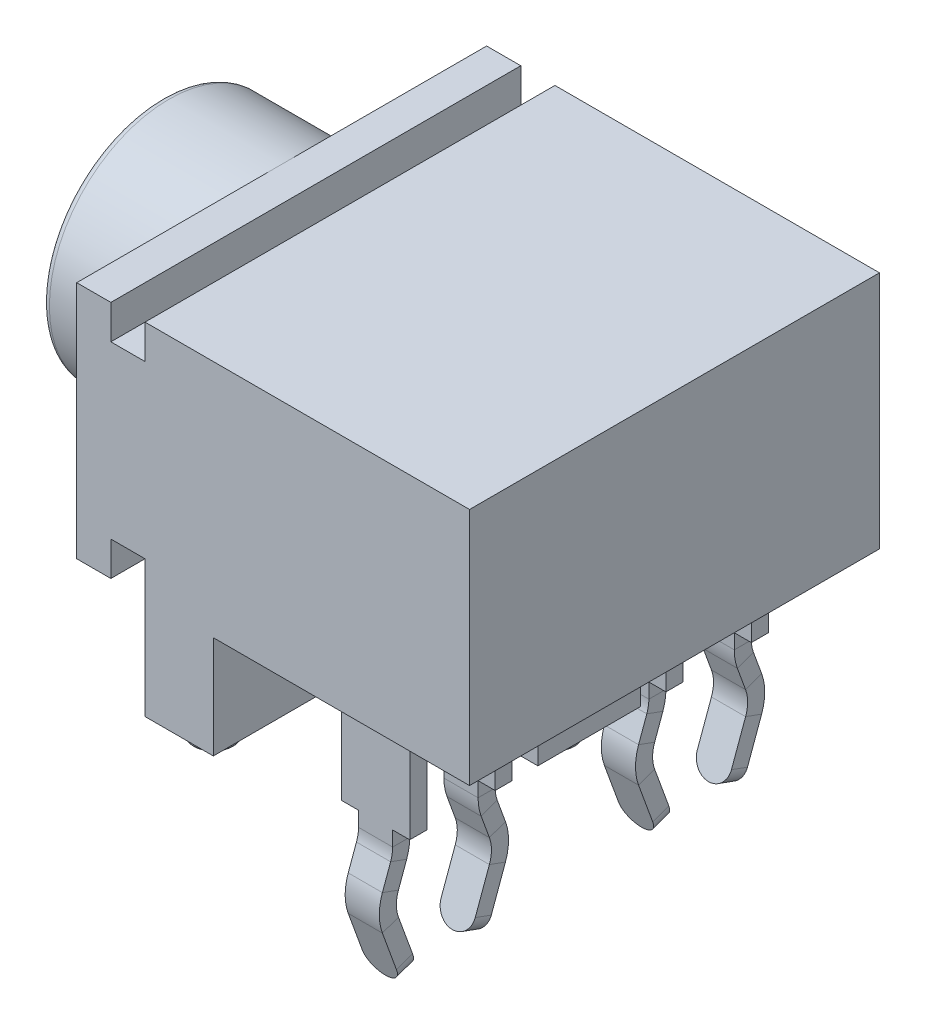
from build123d import *

# Parameters (mm, degrees)
SKETCH1_W              = 11.5
SKETCH1_H              = 12
EXTRUDE_1204_DEPTH     = 10
SKETCH4_R              = 3.5
SKETCH4_R_2            = 1.8
EXTRUDE_1491_DEPTH     = 3.5
FILLET_2_R             = 0.2
SKETCH_4_W             = 1
SKETCH_4_H             = 12
CUT_EXTRUDE_1957_DEPTH = 1
SKETCH_12_W            = 2
SKETCH_12_H            = 12
CUT_EXTRUDE_2288_DEPTH = 3
CUT_EXTRUDE_2733_DEPTH = 3
SKETCH_20_W            = 1
SKETCH_20_H            = 12
CUT_EXTRUDE_2_DEPTH    = 1
SKETCH3_R              = 0.6
EXTRUDE_3529_DEPTH     = 0.5
FILLET_4_R             = 0.1
SM_BASE_FLANGE_1_DEPTH = 0.5
OTHER_START            = 4.5
OTHER_8_DEPTH          = 1
OTHER_8_2_DEPTH        = 1
OTHER_9_DEPTH          = 1
OTHER_9_2_DEPTH        = 1
FILLET_5_R             = 0.499
SKETCH_42_W            = 0.5
SKETCH_42_H            = 4
SM_BASE_FLANGE_3_DEPTH = 1
OTHER_START_2          = -0.25
OTHER_19_DEPTH         = 0.5
OTHER_19_2_DEPTH       = 0.5
OTHER_20_DEPTH         = 0.5
OTHER_20_2_DEPTH       = 0.5
FILLET_6_R             = 0.499


# Read off the part's stored shape, not the designer's step: Нарисованный сгиб8, Нарисованный сгиб9, Нарисованный сгиб19, Нарисованный сгиб20
# Sheet-metal steps are written as plain solids
with BuildPart() as part:
    # Sketch1 → Extrude 1204 (new body)
    with BuildSketch(Plane(origin=(0, 0, 0), x_dir=(1, 0, 0), z_dir=(0, 1, 0))):
        with Locations((2.75, 0)):
            Rectangle(SKETCH1_W, SKETCH1_H)
    extrude(amount=EXTRUDE_1204_DEPTH)

    # Sketch4 → Extrude 1491 (add)
    with BuildSketch(Plane(origin=(-3, 0, 0), x_dir=(0, 0, -1), z_dir=(1, 0, 0))):
        with Locations((0, 6.5)):
            Circle(SKETCH4_R)
        with Locations((0, 6.5)):
            Circle(SKETCH4_R_2, mode=Mode.SUBTRACT)
    extrude(amount=-EXTRUDE_1491_DEPTH)

    # Скругление2
    fillet_2_edges = [part.edges().sort_by_distance(p)[0] for p in [
        (-6.5, 6.5, 3.5),
        (-6.5, 6.5, 1.8),
    ]]
    fillet(fillet_2_edges, radius=FILLET_2_R)

    # Эскиз4 → Cut-Extrude 1957 (cut)
    with BuildSketch(Plane(origin=(0, 10, 0), x_dir=(1, 0, 0), z_dir=(0, 1, 0))):
        with Locations((-1.5, 0)):
            Rectangle(SKETCH_4_W, SKETCH_4_H)
    extrude(amount=-CUT_EXTRUDE_1957_DEPTH, mode=Mode.SUBTRACT)

    # Эскиз12 → Cut-Extrude 2288 (cut)
    with BuildSketch(Plane.XZ):
        with Locations((-2, 0)):
            Rectangle(SKETCH_12_W, SKETCH_12_H)
    extrude(amount=-CUT_EXTRUDE_2288_DEPTH, mode=Mode.SUBTRACT)

    # Эскиз13 → Cut-Extrude 2733 (cut)
    with BuildSketch(Plane.XZ):
        Polygon((1, -6), (8.5, -6), (8.5, 6), (1, 6), (1, 1.5), (6, 1.5), (6, -1.5), (1, -1.5), align=None)
    extrude(amount=-CUT_EXTRUDE_2733_DEPTH, mode=Mode.SUBTRACT)

    # Эскиз20 → Нижний паз 2 (cut)
    with BuildSketch(Plane.XZ.offset(-3)):
        with Locations((-1.5, 0)):
            Rectangle(SKETCH_20_W, SKETCH_20_H)
    extrude(amount=-CUT_EXTRUDE_2_DEPTH, mode=Mode.SUBTRACT)

    # Sketch3 → Extrude 3529 (add)
    with BuildSketch(Plane.XZ):
        with Locations(Location((0, 5, 0), (0, 0, 90))):
            Circle(SKETCH3_R)
        with Locations(Location((5, 0, 0), (0, 0, 90))):
            Circle(SKETCH3_R)
        with Locations(Location((0, -5, 0), (0, 0, 90))):
            Circle(SKETCH3_R)
    extrude(amount=EXTRUDE_3529_DEPTH)

    # Скругление4
    fillet_4_edges = [part.edges().sort_by_distance(p)[0] for p in [
        (0, -0.5, 4.4),
        (5, -0.5, -0.6),
        (0, -0.5, -5.6),
    ]]
    fillet(fillet_4_edges, radius=FILLET_4_R)


with BuildPart() as body_2:
    # Эскиз23 → Базовая кромка1 (new body)
    with BuildSketch(Plane.XY.offset(4.75)):
        Polygon((4, 3), (4, 0), (4.5, 0), (4.5, -4), (5.5, -4), (5.5, 0), (6, 0), (6, 3), align=None)
    extrude(amount=SM_BASE_FLANGE_1_DEPTH)

    # Other 8 outline → Other 8 (cut)
    with BuildSketch(Plane.YZ.offset(OTHER_START)):
        with BuildLine():
            ThreePointArc((-0.434210549, 4.75), (-0.694682816, 4.77278837), (-0.947240764, 4.840461069))
            Line((-0.947240764, 4.840461069), (-2.07243973, 5.25))
            Line((-2.07243973, 5.25), (-4, 5.25))
            Line((-4, 5.25), (-4, 4.75))
            Line((-4, 4.75), (-0.434210549, 4.75))
        make_face()
    extrude(amount=OTHER_8_DEPTH, mode=Mode.SUBTRACT)

    # Other 8 2 outline → Other 8 2 (add)
    with BuildSketch(Plane.YZ.offset(OTHER_START)):
        with BuildLine():
            Line((-3.937170734, 5.92870658), (-2.07243973, 5.25))
            Line((-2.07243973, 5.25), (-0.434210549, 5.25))
            ThreePointArc((-0.434210549, 5.25), (-0.607858727, 5.265192247), (-0.776230693, 5.310307379))
            Line((-0.776230693, 5.310307379), (-3.766160663, 6.398552891))
            Line((-3.766160663, 6.398552891), (-3.937170734, 5.92870658))
        make_face()
    extrude(amount=OTHER_8_2_DEPTH)

    # Other 9 outline → Other 9 (cut)
    with BuildSketch(Plane.YZ.offset(OTHER_START)):
        with BuildLine():
            ThreePointArc((-2.464204349, 5.551224091), (-1.951174134, 5.64168516), (-1.438143919, 5.551224091))
            Line((-1.438143919, 5.551224091), (-3.766160663, 6.398552891))
            Line((-3.766160663, 6.398552891), (-3.937170734, 5.92870658))
            Line((-3.937170734, 5.92870658), (-2.682125234, 5.471907376))
            Line((-2.682125234, 5.471907376), (-2.464204349, 5.551224091))
        make_face()
    extrude(amount=OTHER_9_DEPTH, mode=Mode.SUBTRACT)

    # Other 9 2 outline → Other 9 2 (add)
    with BuildSketch(Plane.YZ.offset(OTHER_START)):
        with BuildLine():
            Line((-1.609153991, 5.081377781), (-2.682125234, 5.471907376))
            Line((-2.682125234, 5.471907376), (-4.070588964, 4.966547907))
            Line((-4.070588964, 4.966547907), (-3.899578893, 4.496701596))
            Line((-3.899578893, 4.496701596), (-2.293194277, 5.081377781))
            ThreePointArc((-2.293194277, 5.081377781), (-1.951174134, 5.14168516), (-1.609153991, 5.081377781))
        make_face()
    extrude(amount=OTHER_9_2_DEPTH)

    # Скругление5
    fillet_5_edges = [body_2.edges().sort_by_distance(p)[0] for p in [
        (4.5, -3.985083928, 4.731624752),
        (5.5, -3.985083928, 4.731624752),
    ]]
    fillet(fillet_5_edges, radius=FILLET_5_R)


with BuildPart() as body_3:
    # Зеркальное отражение1: mirrored copy
    add(body_2.part.mirror(Plane.XY.offset(3.75)))


with BuildPart() as body_4:
    # Зеркальное отражение2: mirrored copy
    add(body_2.part.mirror(Plane.XY))


with BuildPart() as body_5:
    # Mirror 2 2: mirrored copy
    add(body_3.part.mirror(Plane.XY))


with BuildPart() as body_6:
    # Эскиз42 → Базовая кромка3 (new body)
    with BuildSketch(Plane(origin=(0.5, 0, 0), x_dir=(0, 0, -1), z_dir=(1, 0, 0))):
        with Locations((0, -2)):
            Rectangle(SKETCH_42_W, SKETCH_42_H)
    extrude(amount=-SM_BASE_FLANGE_3_DEPTH)

    # Other 19 outline → Other 19 (cut)
    with BuildSketch(Plane.XY.offset(OTHER_START_2)):
        with BuildLine():
            Line((0.454423259, -0.738227417), (-0.120715252, -4))
            Line((-0.120715252, -4), (0.5, -4))
            Line((0.5, -4), (0.5, -0.217282884))
            ThreePointArc((0.5, -0.217282884), (0.488584094, -0.478750112), (0.454423259, -0.738227417))
        make_face()
    extrude(amount=OTHER_19_DEPTH, mode=Mode.SUBTRACT)

    # Other 19 2 outline → Other 19 2 (add)
    with BuildSketch(Plane.XY.offset(OTHER_START_2)):
        with BuildLine():
            ThreePointArc((-0.5, -0.217282884), (-0.507610604, -0.391594369), (-0.530384494, -0.564579239))
            Line((-0.530384494, -0.564579239), (-1.120570314, -3.911689351))
            Line((-1.120570314, -3.911689351), (-0.135762561, -4.085337529))
            Line((-0.135762561, -4.085337529), (-0.120715252, -4))
            Line((-0.120715252, -4), (-0.5, -4))
            Line((-0.5, -4), (-0.5, -0.217282884))
        make_face()
    extrude(amount=OTHER_19_2_DEPTH)

    # Other 20 outline → Other 20 (cut)
    with BuildSketch(Plane.XY.offset(OTHER_START_2)):
        with BuildLine():
            ThreePointArc((-0.590117837, -3.217930711), (-0.759624069, -2.453337509), (-0.725463234, -1.670925748))
            Line((-0.725463234, -1.670925748), (-1.120570314, -3.911689351))
            Line((-1.120570314, -3.911689351), (-0.283915714, -4.059214131))
            Line((-0.283915714, -4.059214131), (-0.590117837, -3.217930711))
        make_face()
    extrude(amount=OTHER_20_DEPTH, mode=Mode.SUBTRACT)

    # Other 20 2 outline → Other 20 2 (add)
    with BuildSketch(Plane.XY.offset(OTHER_START_2)):
        with BuildLine():
            Line((-0.135762561, -4.085337529), (-0.283915714, -4.059214131))
            Line((-0.283915714, -4.059214131), (-0.205887727, -4.273594263))
            Line((-0.205887727, -4.273594263), (0.733804894, -3.93157412))
            Line((0.733804894, -3.93157412), (0.349574784, -2.875910568))
            ThreePointArc((0.349574784, -2.875910568), (0.236570629, -2.366181767), (0.259344519, -1.844573926))
            Line((0.259344519, -1.844573926), (-0.135762561, -4.085337529))
        make_face()
    extrude(amount=OTHER_20_2_DEPTH)

    # Скругление6
    fillet_6_edges = [body_6.edges().sort_by_distance(p)[0] for p in [
        (-0.205887727, -4.273594263, 0),
        (0.733804894, -3.93157412, 0),
    ]]
    fillet(fillet_6_edges, radius=FILLET_6_R)


solid = Compound([part.part, body_2.part, body_3.part, body_4.part, body_5.part, body_6.part])
